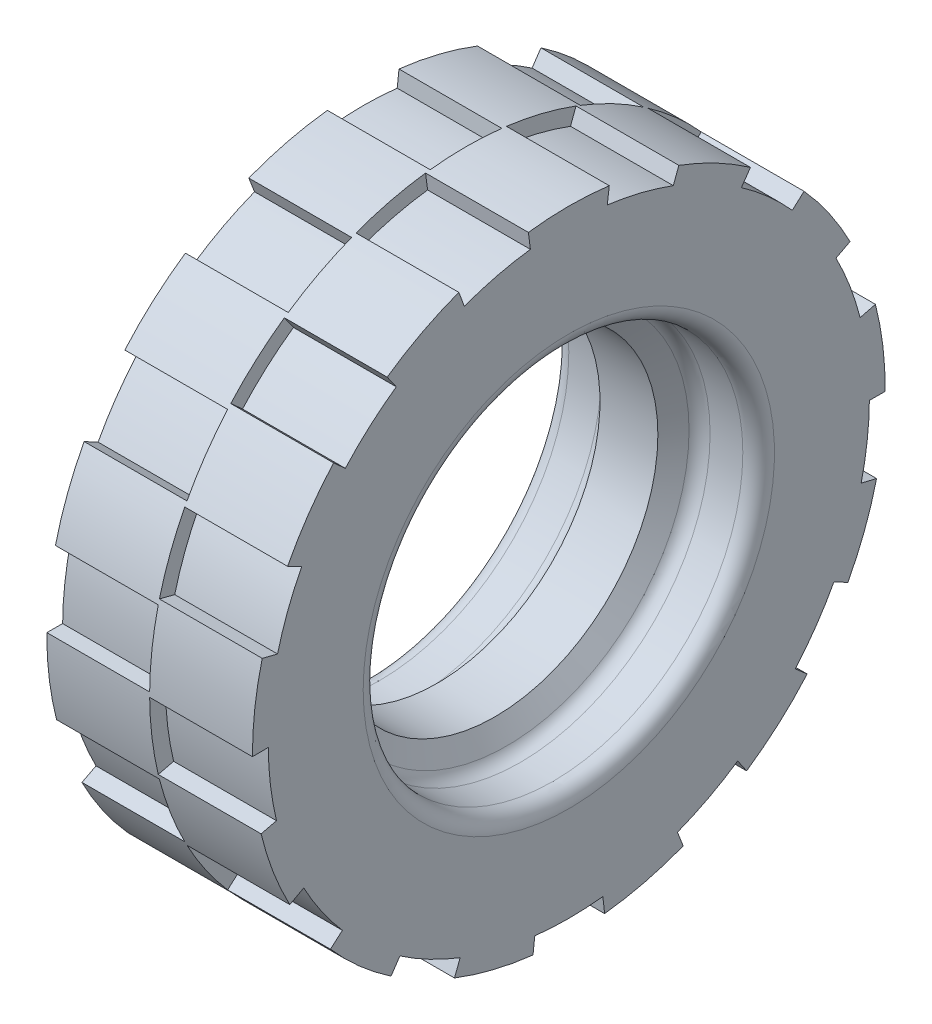
from build123d import *

# Parameters (mm, degrees)
CUT_EXTRUDE1_START = -3.25
CUT_EXTRUDE1_DEPTH = 3.25
CIRPATTERN1_COUNT  = 13
CUT_EXTRUDE2_DEPTH = 3.25
CIRPATTERN2_COUNT  = 13
FILLET1_R          = 0.5


with BuildPart() as part:
    # Sketch1 → Revolve1 (revolve)
    with BuildSketch(Plane.XY):
        Polygon((-3.25, 10), (3.25, 10), (3.25, 6), (1.435, 6), (0.915, 5.15), (-0.915, 5.15), (-1.435, 6), (-3.25, 6), align=None)
    revolve(axis=Axis((0, 0, 0), (1, 0, 0)))

    # Sketch2 → Cut-Extrude1 (cut)
    with BuildSketch(Plane.ZY.offset(3.25).offset(CUT_EXTRUDE1_START)):
        with BuildLine():
            Line((-1.075430531, 9.438932629), (-1.132032138, 9.935718557))
            ThreePointArc((-1.132032138, 9.935718557), (0, 10), (1.132032138, 9.935718557))
            Line((1.132032138, 9.935718557), (1.075430531, 9.438932629))
            ThreePointArc((1.075430531, 9.438932629), (0, 9.5), (-1.075430531, 9.438932629))
        make_face()
    cut_extrude1 = extrude(amount=CUT_EXTRUDE1_DEPTH, mode=Mode.SUBTRACT)

    # CirPattern1: Cut-Extrude1 ×13 about axis
    cirpattern1_axis = Axis((-3.25, 0, 0), (-1, 0, 0))
    for i in range(1, CIRPATTERN1_COUNT):
        add(cut_extrude1.rotate(cirpattern1_axis, i * 360 / CIRPATTERN1_COUNT), mode=Mode.SUBTRACT)

    # Sketch3 → Cut-Extrude2 (cut)
    with BuildSketch(Plane(origin=(3.25, 0, 0), x_dir=(0, 0, -1), z_dir=(1, 0, 0))):
        with BuildLine():
            Line((-3.302885527, 8.907353546), (-3.476721607, 9.376161627))
            ThreePointArc((-3.476721607, 9.376161627), (-2.39296111, 9.709466367), (-1.278436014, 9.917943404))
            Line((-1.278436014, 9.917943404), (-1.214514213, 9.422046233))
            ThreePointArc((-1.214514213, 9.422046233), (-2.273313055, 9.223993048), (-3.302885527, 8.907353546))
        make_face()
    cut_extrude2 = extrude(amount=-CUT_EXTRUDE2_DEPTH, mode=Mode.SUBTRACT)

    # CirPattern2: Cut-Extrude2 ×13 about axis
    cirpattern2_axis = Axis((3.25, 0, 0), (-1, 0, 0))
    for i in range(1, CIRPATTERN2_COUNT):
        add(cut_extrude2.rotate(cirpattern2_axis, i * 360 / CIRPATTERN2_COUNT), mode=Mode.SUBTRACT)

    # Fillet1
    fillet1_edges = [part.edges().sort_by_distance(p)[0] for p in [
        (3.25, -6, 0),
        (-3.25, -6, 0),
        (1.435, -6, 0),
        (-1.435, -6, 0),
    ]]
    fillet(fillet1_edges, radius=FILLET1_R)


solid = part.part
